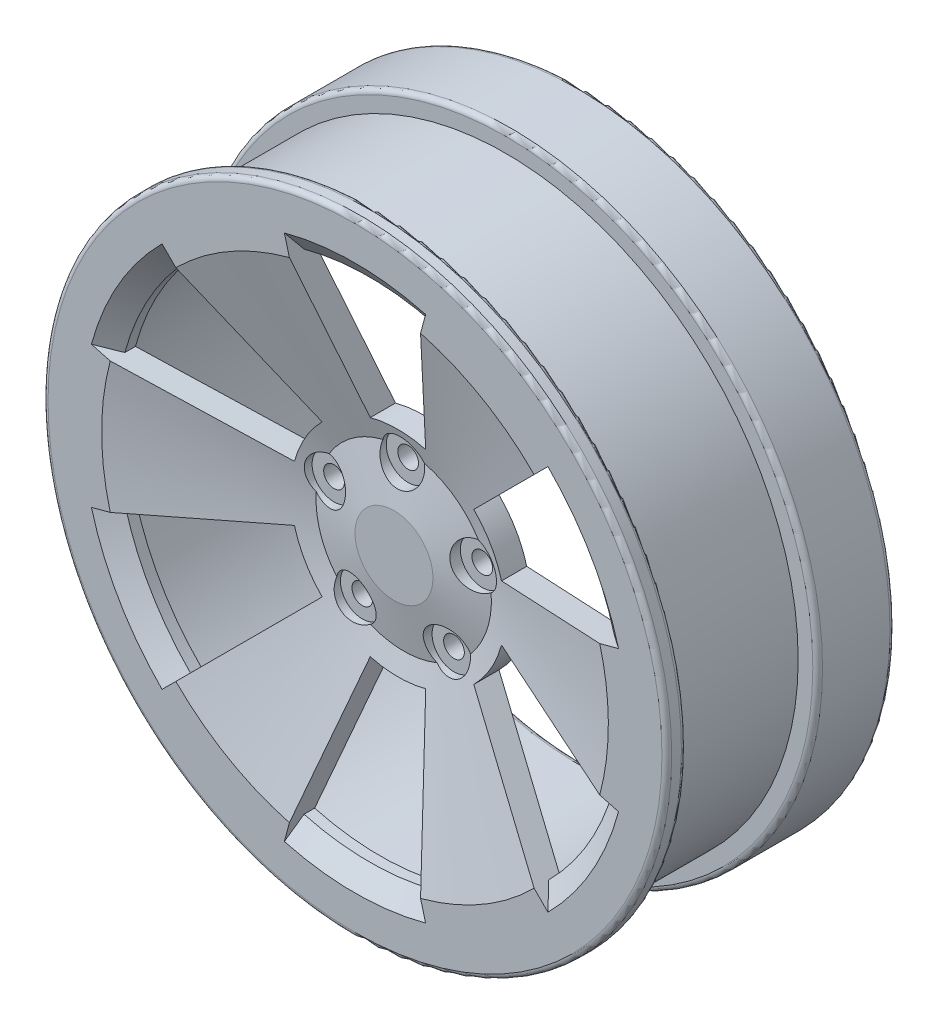
from build123d import *

# Parameters (mm, degrees)
CUT_EXTRUDE1_DEPTH = 324.51115613
CIRPATTERN1_COUNT  = 6
CIRPATTERN2_COUNT  = 5
CHAMFER1_SIZE      = 12.7
CHAMFER1_SIZE_2    = 9.525
CHAMFER7_SIZE      = 12.7
CHAMFER7_SIZE2     = 9.525


with BuildPart() as part:
    # Sketch2 → Revolve1 (revolve)
    with BuildSketch(Plane(origin=(0, 0, 0), x_dir=(0, 0, -1), z_dir=(1, 0, 0)), mode=Mode.PRIVATE) as revolve1_sk:
        with BuildLine():
            Line((0, 165.1), (0, 200.025))
            ThreePointArc((0, 200.025), (0.92993597, 202.27006403), (3.175, 203.2))
            Line((3.175, 203.2), (9.525, 203.2))
            ThreePointArc((9.525, 203.2), (11.77006403, 202.27006403), (12.7, 200.025))
            Line((12.7, 200.025), (12.7, 190.5))
            Line((12.7, 190.5), (98.298, 190.5))
            Line((98.298, 190.5), (98.298, 200.025))
            ThreePointArc((98.298, 200.025), (99.22793597, 202.27006403), (101.473, 203.2))
            Line((101.473, 203.2), (145.415, 203.2))
            ThreePointArc((145.415, 203.2), (147.66006403, 202.27006403), (148.59, 200.025))
            Line((148.59, 200.025), (148.59, 180.975))
            ThreePointArc((148.59, 180.975), (147.66006403, 178.72993597), (145.415, 177.8))
            Line((145.415, 177.8), (12.7, 177.8))
            Line((12.7, 177.8), (44.45, 69.85))
            Line((44.45, 69.85), (44.45, 0))
            Line((44.45, 0), (25.4, 0))
            Line((25.4, 0), (25.4, 25.4))
            Line((25.4, 25.4), (31.75, 57.15))
            Line((31.75, 57.15), (0, 165.1))
        make_face()
    revolve(revolve1_sk.sketch.rotate(Axis((0, 0, -25.4), (0, 0, -1)), 90), axis=Axis((0, 0, -25.4), (0, 0, -1)))

    # Sketch3 → Cut-Extrude1 (cut, through all)
    with BuildSketch(Plane.XY):
        with BuildLine():
            Line((-18.0785103, 67.469918966), (-42.731024346, 159.47435392))
            ThreePointArc((-42.731024346, 159.47435392), (0, 165.1), (42.731024346, 159.47435392))
            Line((42.731024346, 159.47435392), (18.0785103, 67.469918966))
            ThreePointArc((18.0785103, 67.469918966), (0, 69.85), (-18.0785103, 67.469918966))
        make_face()
    cut_extrude1 = extrude(amount=-CUT_EXTRUDE1_DEPTH, mode=Mode.SUBTRACT)

    # CirPattern1: Cut-Extrude1 ×6 about axis
    cirpattern1_axis = Axis((0, 0, 0), (0, 0, 1))
    for i in range(1, CIRPATTERN1_COUNT):
        add(cut_extrude1.rotate(cirpattern1_axis, i * 360 / CIRPATTERN1_COUNT), mode=Mode.SUBTRACT)

    # Sketch7 → CBORE for 1/2 Hex Head Bolt2 (revolve, cut)
    with BuildSketch(Plane(origin=(0, 50.8, -25.4), x_dir=(0, -1, 0), z_dir=(1, 0, 0))):
        Polygon((0, 0), (0, 123.19), (6.74624, 123.19), (6.74624, 9.2456), (14.2875, 9.2456), (14.2875, 0.730483939), (14.9225, 0), align=None)
    cbore_for_1_2_hex_head_bolt2 = revolve(axis=Axis((0, 50.8, -19.05), (0, 0, -1)), mode=Mode.SUBTRACT)

    # CirPattern2: CBORE for 1/2 Hex Head Bolt2 ×5 about axis
    cirpattern2_axis = Axis((0, 0, 0), (0, 0, 1))
    for i in range(1, CIRPATTERN2_COUNT):
        add(cbore_for_1_2_hex_head_bolt2.rotate(cirpattern2_axis, i * 360 / CIRPATTERN2_COUNT), mode=Mode.SUBTRACT)

    # Chamfer1
    # the kernel refuses this chamfer: 12.7, 9.525 mm, written as the material it takes off along each edge
    with BuildSketch(Plane(origin=(0, 0, 0), x_dir=(0.707106781186549, 0.7071067811865461, 0), z_dir=(-0.7071067811865461, 0.707106781186549, 0))) as chamfer1_piece_1:
        Polygon((165.1 + CHAMFER1_SIZE, 0), (165.1, CHAMFER1_SIZE_2), (165.1, 0), align=None)
    revolve(axis=Axis((0, 0, 0), (0, 0, -1)), revolution_arc=30, mode=Mode.SUBTRACT)

    # Chamfer7
    chamfer7_edges = [part.edges().sort_by_distance(p)[0] for p in [
        (0, -165.1, 0),
        (-142.980794165, -82.55, 0),
        (-142.980794165, 82.55, 0),
        (0, 165.1, 0),
        (142.980794165, -82.55, 0),
    ]]
    chamfer7_side = [part.faces().sort_by_distance(p)[0] for p in [
        (-194.367438644, 0, 0),
    ]]
    chamfer(chamfer7_edges, length=CHAMFER7_SIZE, length2=CHAMFER7_SIZE2, reference=chamfer7_side[0])


solid = part.part
